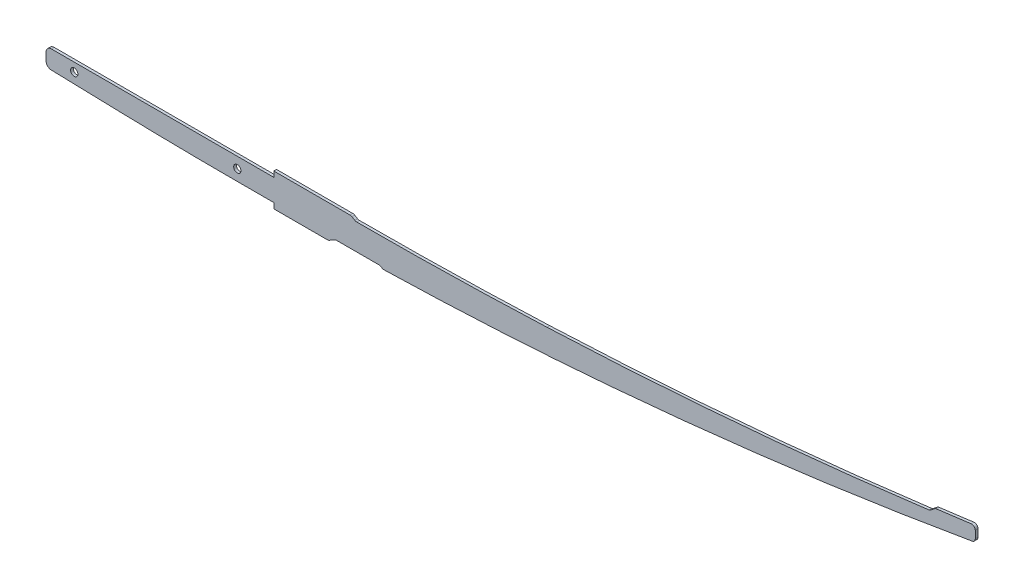
from build123d import *

# Parameters (mm, degrees)
SKETCH_1_R      = 4.01
EXTRUDE_1_DEPTH = 1.5
FILLET_1_R      = 4
FILLET_3_R      = 4


with BuildPart() as part:
    # 草图1 → 凸台-拉伸1 (new, symmetric)
    with BuildSketch(Plane.XY):
        with BuildLine():
            Line((84.803847577, 18), (0, 18))
            Line((0, 18), (0, 12))
            Line((0, 12), (-244, 12))
            ThreePointArc((-244, 12), (-248.242640687, 10.242640687), (-250, 6))
            Line((-250, 6), (-250, -2.163248404))
            ThreePointArc((-250, -2.163248404), (-248.300744725, -6.346978177), (-244.165468396, -8.160966321))
            Line((-244.165468396, -8.160966321), (-170, -10.207084742))
            ThreePointArc((-170, -10.207084742), (-105.006181524, -11.551749873), (-40, -12))
            Line((-40, -12), (0, -12))
            Line((0, -12), (0, -18))
            Line((0, -18), (60, -18))
            Line((60, -18), (67.794228634, -13.5))
            Line((67.794228634, -13.5), (116.535898385, -13.5))
            Line((116.535898385, -13.5), (120, -15.5))
            ThreePointArc((120, -15.5), (245.102223793, -10.50572929), (370, -1.784798366))
            ThreePointArc((370, -1.784798366), (570.5713951, 19.693988186), (770, 50))
            Line((770, 50), (770, 66))
            Line((770, 66), (726.301070379, 60.314142623))
            Line((726.301070379, 60.314142623), (720, 55.49428301))
            ThreePointArc((720, 55.49428301), (510.39414984, 32.865193118), (300, 19.411946527))
            ThreePointArc((300, 19.411946527), (195.023170387, 16.103108317), (90, 15))
            Line((90, 15), (84.803847577, 18))
        make_face()
        with Locations((-219, 2.464367911)):
            Circle(SKETCH_1_R, mode=Mode.SUBTRACT)
        with Locations((-40, 0.082202333)):
            Circle(SKETCH_1_R, mode=Mode.SUBTRACT)
    extrude(amount=EXTRUDE_1_DEPTH, both=True)

    # 圆角1
    fillet_1_edges = [part.edges().sort_by_distance(p)[0] for p in [
        (770, 66, 0),
        (770, 50, 0),
    ]]
    fillet(fillet_1_edges, radius=FILLET_1_R)

    # 圆角3
    fillet_3_edges = [part.edges().sort_by_distance(p)[0] for p in [
        (720, 55.49428301, 0),
        (726.301070379, 60.314142623, 0),
        (90, 15, 0),
        (84.803847577, 18, 0),
        (120, -15.5, 0),
        (116.535898385, -13.5, 0),
        (67.794228634, -13.5, 0),
        (60, -18, 0),
    ]]
    fillet(fillet_3_edges, radius=FILLET_3_R)


solid = part.part
